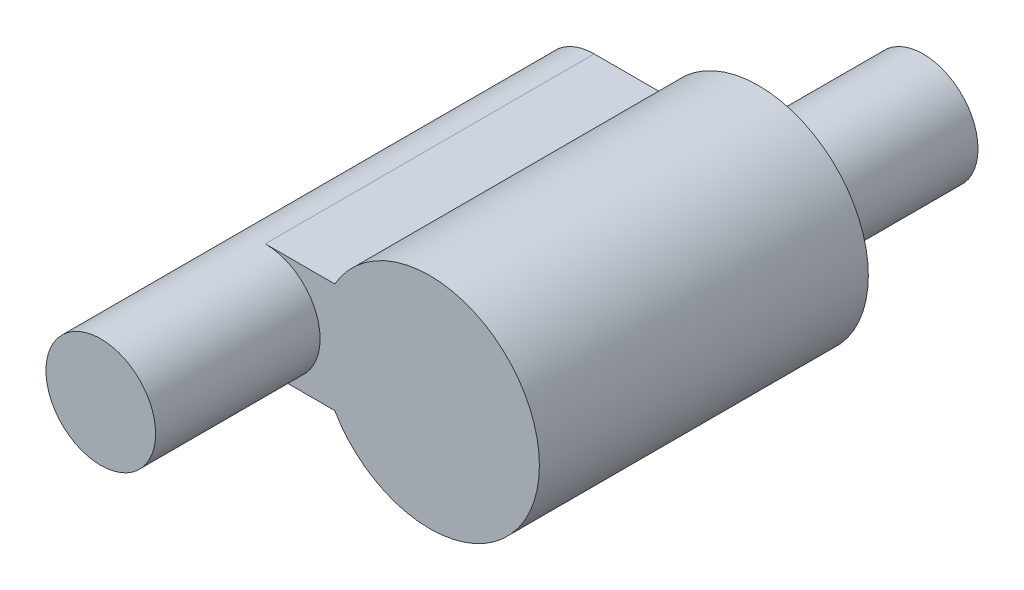
from build123d import *

# Parameters (mm, degrees)
BOSS_EXTRUDE1_DEPTH = 6
SKETCH2_R           = 1
BOSS_EXTRUDE2_DEPTH = 3
SKETCH3_R           = 1
BOSS_EXTRUDE3_DEPTH = 3


with BuildPart() as part:
    # Sketch1 → Boss-Extrude1 (new body)
    with BuildSketch(Plane.XY):
        with BuildLine():
            Line((-5.566278852, 8.847888353), (-6.834228044, 8.847888353))
            ThreePointArc((-6.834228044, 8.847888353), (-7.834228044, 7.847888353), (-6.834228044, 6.847888353))
            Line((-6.834228044, 6.847888353), (-5.566278852, 6.847888353))
            ThreePointArc((-5.566278852, 6.847888353), (-1.834228044, 7.847888353), (-5.566278852, 8.847888353))
        make_face()
    extrude(amount=BOSS_EXTRUDE1_DEPTH)

    # Sketch2 → Boss-Extrude2 (add)
    with BuildSketch(Plane.XY.offset(6)):
        with Locations((-6.834228044, 7.847888353)):
            Circle(SKETCH2_R)
    extrude(amount=BOSS_EXTRUDE2_DEPTH)

    # Sketch3 → Boss-Extrude3 (add)
    with BuildSketch(Plane(origin=(0, 0, 0), x_dir=(-1, 0, 0), z_dir=(0, 0, -1))):
        with Locations((3.834228044, 7.847888353)):
            Circle(SKETCH3_R)
    extrude(amount=BOSS_EXTRUDE3_DEPTH)


solid = part.part
